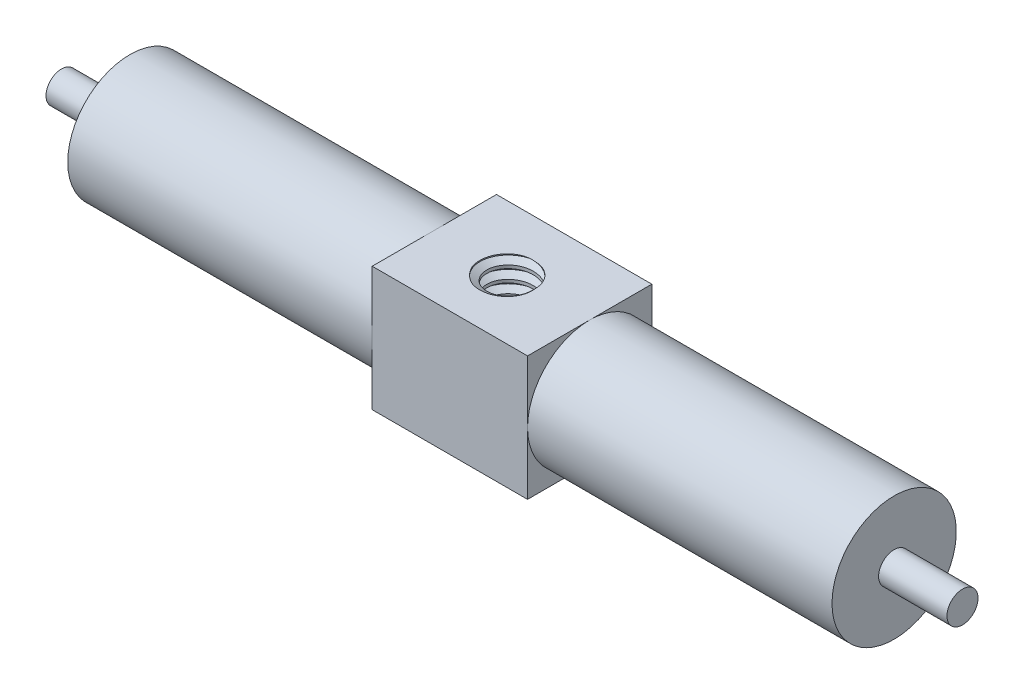
from build123d import *

# Parameters (mm, degrees)
SKETCH2_W           = 50
SKETCH2_H           = 40
BOSS_EXTRUDE1_DEPTH = 20
SKETCH3_R           = 7.5
CUT_EXTRUDE1_DEPTH  = 152.739909055
THREAD1_PITCH       = 4


with BuildPart() as part:
    # Sketch1 → Revolve1 (revolve)
    with BuildSketch(Plane.XY, mode=Mode.PRIVATE) as revolve1_sk:
        Polygon((-145, 0), (-145, 5), (-123, 5), (-123, 20), (123, 20), (123, 5), (145, 5), (145, 0), align=None)
    revolve(revolve1_sk.sketch.rotate(Axis((-145, 0, 0), (1, 0, 0)), 90), axis=Axis((-145, 0, 0), (1, 0, 0)))

    # Sketch2 → Boss-Extrude1 (add, symmetric)
    with BuildSketch(Plane(origin=(0, 0, 0), x_dir=(1, 0, 0), z_dir=(0, 1, 0))):
        Rectangle(SKETCH2_W, SKETCH2_H)
    extrude(amount=BOSS_EXTRUDE1_DEPTH, both=True)

    # Sketch3 → Cut-Extrude1 (cut, through all)
    with BuildSketch(Plane(origin=(0, 20, 0), x_dir=(1, 0, 0), z_dir=(0, 1, 0))):
        with Locations(Location((0, 0, 0), (0, 0, 270))):
            Circle(SKETCH3_R)
    extrude(amount=-CUT_EXTRUDE1_DEPTH, mode=Mode.SUBTRACT)

    # Thread1: the profile of Thread Profile1 profile screwed along a right-hand helix of 10 turns, 12 arcs to a turn; built about Z, then put on its axis
    thread1_z = Axis((0, 0, 0), (0, 0, 1))
    thread1_corners = [(7.4997, 0, -0.000173205), (9.6650635, 0, 1.249999995), (9.6650635, 0, 1.749999995), (7.4997, 0, 3.000173194)]
    with BuildLine(mode=Mode.PRIVATE) as thread1_profile:
        Line(thread1_corners[0], thread1_corners[1])
        Line(thread1_corners[1], thread1_corners[2])
        Line(thread1_corners[2], thread1_corners[3])
        Line(thread1_corners[3], thread1_corners[0])
    thread1_cap = Face(thread1_profile.wire())
    thread1_turn_angles = [0, 15, 30, 45, 60, 75, 90, 105, 120, 135, 150, 165, 180, 195, 210, 225, 240, 255, 270, 285, 300, 315, 330, 345, 360]
    thread1_turn_weights = [1, 0.9659258262890683, 1, 0.9659258262890683, 1, 0.9659258262890683, 1, 0.9659258262890683, 1, 0.9659258262890683, 1, 0.9659258262890683, 1, 0.9659258262890683, 1, 0.9659258262890683, 1, 0.9659258262890683, 1, 0.9659258262890683, 1, 0.9659258262890683, 1, 0.9659258262890683, 1]
    thread1_turn_rails = [Edge.make_bspline([Vector(p[0], p[1], 0).rotate(thread1_z, thread1_turn_angles[k]) / thread1_turn_weights[k] + Vector(0, 0, p[2] + THREAD1_PITCH * thread1_turn_angles[k] / 360) for k in range(25)], [0, 0, 0, 1, 1, 2, 2, 3, 3, 4, 4, 5, 5, 6, 6, 7, 7, 8, 8, 9, 9, 10, 10, 11, 11, 12, 12, 12], 2, thread1_turn_weights) for p in thread1_corners]
    thread1_turn_sides = [Face.make_surface_from_curves(thread1_turn_rails[p[0]], thread1_turn_rails[p[1]]) for p in [(0, 1), (1, 2), (2, 3), (3, 0)]]
    thread1 = Plane(origin=(0, -20, 0), x_dir=(1, 0, 0), z_dir=(0, 1, 0)) * Solid(Shell([*[p.moved(Location((0, 0, THREAD1_PITCH * i))) for i in range(10) for p in thread1_turn_sides], thread1_cap, thread1_cap.rotate(thread1_z, 3600).moved(Location((0, 0, THREAD1_PITCH * 3600 / 360)))]))
    add(thread1, mode=Mode.SUBTRACT)


solid = part.part
